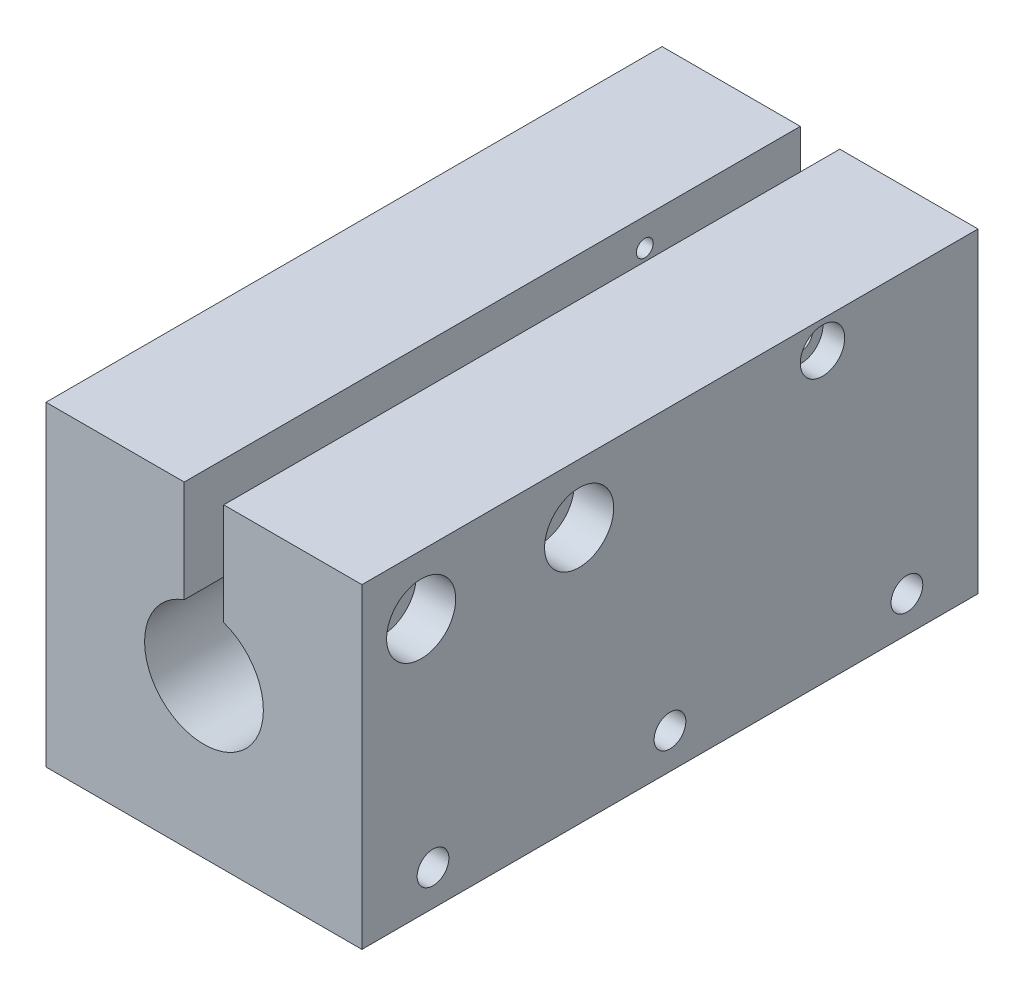
from build123d import *

# Parameters (mm, degrees)
SKETCH1_W                                    = 50.8
SKETCH1_H                                    = 50.8
BOSS_EXTRUDE1_DEPTH                          = 99.06
SKETCH2_R                                    = 16.75
CUT_EXTRUDE1_DEPTH                           = 43.18
SKETCH3_R                                    = 9.5504
CUT_EXTRUDE2_DEPTH                           = 92.015682165
SKETCH6_W                                    = 6.35
SKETCH6_H                                    = 25.4
CUT_EXTRUDE3_DEPTH                           = 123.36896502
CBORE_START                                  = 28.575
CBORE_FOR_1_4_SOCKET_HEAD_CAP_SCREW1_OUT_R   = 3.3782
CBORE_FOR_1_4_SOCKET_HEAD_CAP_SCREW1_DEPTH   = 22.225
CBORE_START_2                                = 44.45
CBORE_FOR_1_4_SOCKET_HEAD_CAP_SCREW1_2_O_R   = 5.55625
CBORE_FOR_1_4_SOCKET_HEAD_CAP_SCREW1_2_O_R_2 = 3.3782
CBORE_FOR_1_4_SOCKET_HEAD_CAP_SCREW1_2_DEPTH = 6.35
F_1_4_20_TAPPED_HOLE1_D                      = 5.1054
CBORE_FOR_6_SOCKET_HEAD_CAP_SCREW1_OUTL_R    = 1.89865
CBORE_FOR_6_SOCKET_HEAD_CAP_SCREW1_DEPTH     = 22.225
CBORE_START_3                                = 47.2948
CBORE_FOR_6_SOCKET_HEAD_CAP_SCREW1_2_OU_R    = 3.57251
CBORE_FOR_6_SOCKET_HEAD_CAP_SCREW1_2_OU_R_2  = 1.89865
CBORE_FOR_6_SOCKET_HEAD_CAP_SCREW1_2_DEPTH   = 3.5052
F_6_32_TAPPED_HOLE1_D                        = 2.7051
F_1_4_20_TAPPED_HOLE2_D                      = 5.1054
F_1_4_20_TAPPED_HOLE2_DEPTH                  = 16.51
F_1_4_20_TAPPED_HOLE2_TIP                    = 1.533816902
F_1_4_20_TAPPED_HOLE3_D                      = 5.1054
F_1_4_20_TAPPED_HOLE3_DEPTH                  = 16.51
F_1_4_20_TAPPED_HOLE3_TIP                    = 1.533816902


# Read off the part's stored shape, not the designer's step: CBORE for 1/4 Socket Head Cap Screw1, CBORE for #6 Socket Head Cap Screw1
with BuildPart() as part:
    # Sketch1 → Boss-Extrude1 (new body)
    with BuildSketch(Plane.XY):
        with Locations((25.4, 25.4)):
            Rectangle(SKETCH1_W, SKETCH1_H)
    extrude(amount=BOSS_EXTRUDE1_DEPTH)

    # Sketch2 → Cut-Extrude1 (cut)
    with BuildSketch(Plane(origin=(0, 0, 0), x_dir=(-1, 0, 0), z_dir=(0, 0, -1))):
        with Locations((-25.4, 25.4)):
            Circle(SKETCH2_R)
    extrude(amount=-CUT_EXTRUDE1_DEPTH, mode=Mode.SUBTRACT)

    # Sketch3 → Cut-Extrude2 (cut, through all)
    with BuildSketch(Plane(origin=(0, 0, 43.18), x_dir=(-1, 0, 0), z_dir=(0, 0, -1))):
        with Locations((-25.4, 25.4)):
            Circle(SKETCH3_R)
    extrude(amount=-CUT_EXTRUDE2_DEPTH, mode=Mode.SUBTRACT)

    # Sketch6 → Cut-Extrude3 (cut, through all)
    with BuildSketch(Plane(origin=(0, 0, 0), x_dir=(-1, 0, 0), z_dir=(0, 0, -1))):
        with Locations((-25.4, 38.1)):
            Rectangle(SKETCH6_W, SKETCH6_H)
    extrude(amount=-CUT_EXTRUDE3_DEPTH, mode=Mode.SUBTRACT)

    # CBORE for 1/4 Socket Head Cap Screw1 out → CBORE for 1/4 Socket Head Cap Screw1 (cut)
    with BuildSketch(Plane.YZ.offset(CBORE_START)):
        with Locations((41.275, 64.135)):
            Circle(CBORE_FOR_1_4_SOCKET_HEAD_CAP_SCREW1_OUT_R)
        with Locations((41.275, 89.535)):
            Circle(CBORE_FOR_1_4_SOCKET_HEAD_CAP_SCREW1_OUT_R)
    extrude(amount=CBORE_FOR_1_4_SOCKET_HEAD_CAP_SCREW1_DEPTH, mode=Mode.SUBTRACT)

    # CBORE for 1_4 Socket Head Cap Screw1 2 o → CBORE for 1_4 Socket Head Cap Screw1 2 (cut)
    # profile 1 of 2: a face of its own
    with BuildSketch(Plane.YZ.offset(CBORE_START_2)):
        with Locations((41.275, 64.135)):
            Circle(CBORE_FOR_1_4_SOCKET_HEAD_CAP_SCREW1_2_O_R)
        with Locations((41.275, 64.135)):
            Circle(CBORE_FOR_1_4_SOCKET_HEAD_CAP_SCREW1_2_O_R_2, mode=Mode.SUBTRACT)
    # profile 2 of 2: a face of its own
    with BuildSketch(Plane.YZ.offset(CBORE_START_2)):
        with Locations((41.275, 89.535)):
            Circle(CBORE_FOR_1_4_SOCKET_HEAD_CAP_SCREW1_2_O_R)
        with Locations((41.275, 89.535)):
            Circle(CBORE_FOR_1_4_SOCKET_HEAD_CAP_SCREW1_2_O_R_2, mode=Mode.SUBTRACT)
    extrude(amount=CBORE_FOR_1_4_SOCKET_HEAD_CAP_SCREW1_2_DEPTH, mode=Mode.SUBTRACT)

    # 1/4-20 Tapped Hole1 (through all)
    with Locations(Plane(origin=(22.225, 0, 0), x_dir=(0, 0, -1), z_dir=(1, 0, 0))):
        with Locations((-89.535, 41.275), (-64.135, 41.275)):
            Hole(F_1_4_20_TAPPED_HOLE1_D / 2)

    # CBORE for #6 Socket Head Cap Screw1 outl → CBORE for #6 Socket Head Cap Screw1 (cut)
    with BuildSketch(Plane.YZ.offset(CBORE_START)):
        with Locations((46.355, 25)):
            Circle(CBORE_FOR_6_SOCKET_HEAD_CAP_SCREW1_OUTL_R)
    extrude(amount=CBORE_FOR_6_SOCKET_HEAD_CAP_SCREW1_DEPTH, mode=Mode.SUBTRACT)

    # CBORE for _6 Socket Head Cap Screw1 2 ou → CBORE for _6 Socket Head Cap Screw1 2 (cut)
    with BuildSketch(Plane.YZ.offset(CBORE_START_3)):
        with Locations((46.355, 25)):
            Circle(CBORE_FOR_6_SOCKET_HEAD_CAP_SCREW1_2_OU_R)
        with Locations((46.355, 25)):
            Circle(CBORE_FOR_6_SOCKET_HEAD_CAP_SCREW1_2_OU_R_2, mode=Mode.SUBTRACT)
    extrude(amount=CBORE_FOR_6_SOCKET_HEAD_CAP_SCREW1_2_DEPTH, mode=Mode.SUBTRACT)

    # #6-32 Tapped Hole1 (through all)
    with Locations(Plane(origin=(22.225, 0, 0), x_dir=(0, 0, -1), z_dir=(1, 0, 0))):
        with Locations((-25, 46.355)):
            Hole(F_6_32_TAPPED_HOLE1_D / 2)

    # 1/4-20 Tapped Hole2
    with Locations(Plane(origin=(50.8, 0, 0), x_dir=(0, 0, -1), z_dir=(1, 0, 0))):
        with Locations((-87.63, 5.715), (-49.53, 5.715), (-11.43, 5.715)):
            Hole(F_1_4_20_TAPPED_HOLE2_D / 2, depth=F_1_4_20_TAPPED_HOLE2_DEPTH)
            with Locations((0, 0, -(F_1_4_20_TAPPED_HOLE2_DEPTH + F_1_4_20_TAPPED_HOLE2_TIP / 2))):  # 118° drill point
                Cone(0, F_1_4_20_TAPPED_HOLE2_D / 2, F_1_4_20_TAPPED_HOLE2_TIP, mode=Mode.SUBTRACT)

    # 1/4-20 Tapped Hole3
    with Locations(Plane.ZY):
        with Locations((11.43, 5.715), (49.53, 5.715), (87.63, 5.715)):
            Hole(F_1_4_20_TAPPED_HOLE3_D / 2, depth=F_1_4_20_TAPPED_HOLE3_DEPTH)
            with Locations((0, 0, -(F_1_4_20_TAPPED_HOLE3_DEPTH + F_1_4_20_TAPPED_HOLE3_TIP / 2))):  # 118° drill point
                Cone(0, F_1_4_20_TAPPED_HOLE3_D / 2, F_1_4_20_TAPPED_HOLE3_TIP, mode=Mode.SUBTRACT)


solid = part.part
